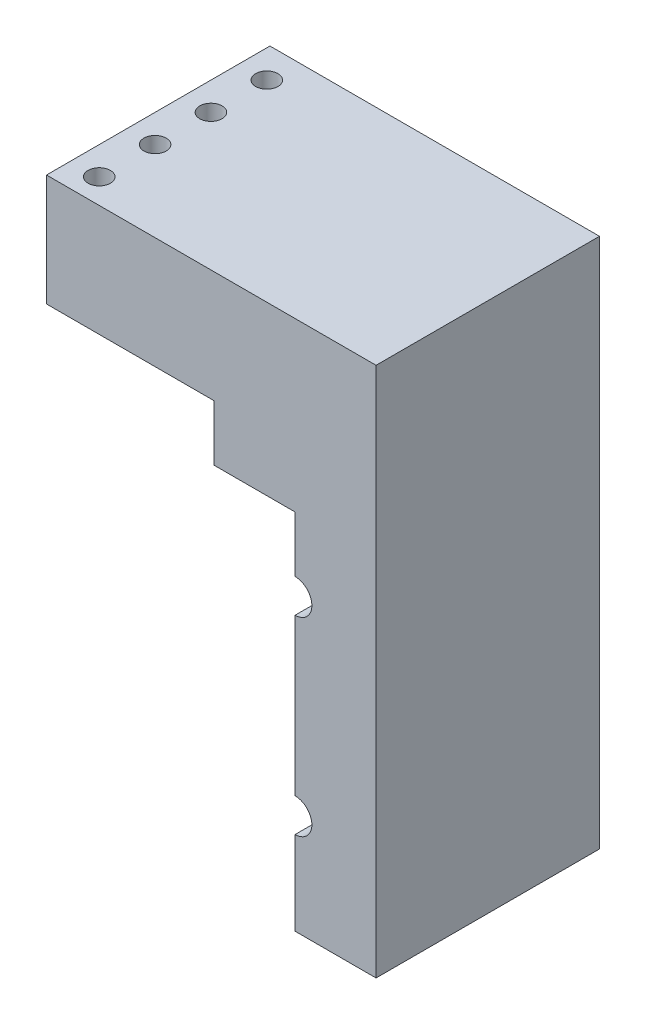
from build123d import *

# Parameters (mm, degrees)
SKETCH_3_W          = 29
SKETCH_3_H          = 95
EXTRUDE_1_DEPTH     = 40
SKETCH_4_R          = 3.005
CUT_EXTRUDE_1_DEPTH = 108.079409785
SKETCH_6_W          = 40
SKETCH_6_H          = 20
EXTRUDE_3_DEPTH     = 30
SKETCH_7_W          = 14.5
SKETCH_7_H          = 65
CUT_EXTRUDE_2_DEPTH = 108.354552768
SKETCH_9_R          = 2
CUT_EXTRUDE_4_DEPTH = 5
SKETCH_10_R         = 2
CUT_EXTRUDE_5_DEPTH = 5
SKETCH_11_R         = 2
CUT_EXTRUDE_6_DEPTH = 5
SKETCH_12_R         = 2
CUT_EXTRUDE_7_DEPTH = 5


with BuildPart() as part:
    # 草图3 → 凸台-拉伸1 (new body)
    with BuildSketch(Plane.XY):
        with Locations((14.5, 47.5)):
            Rectangle(SKETCH_3_W, SKETCH_3_H)
    extrude(amount=EXTRUDE_1_DEPTH)

    # 草图4 → 切除-拉伸1 (cut, through all)
    with BuildSketch(Plane.XY.offset(40)):
        with Locations((14.5, 52)):
            Circle(SKETCH_4_R)
        with Locations((14.5, 18)):
            Circle(SKETCH_4_R)
    extrude(amount=-CUT_EXTRUDE_1_DEPTH, mode=Mode.SUBTRACT)

    # 草图6 → 凸台-拉伸3 (add)
    with BuildSketch(Plane.ZY):
        with Locations((20, 85)):
            Rectangle(SKETCH_6_W, SKETCH_6_H)
    extrude(amount=EXTRUDE_3_DEPTH)

    # 草图7 → 切除-拉伸2 (cut, through all)
    with BuildSketch(Plane.XY.offset(40)):
        with Locations((7.25, 32.5)):
            Rectangle(SKETCH_7_W, SKETCH_7_H)
    extrude(amount=-CUT_EXTRUDE_2_DEPTH, mode=Mode.SUBTRACT)

    # 草图9 → 切除-拉伸4 (cut)
    with BuildSketch(Plane.ZY.offset(-14.5)):
        with Locations((5, 60.0025)):
            Circle(SKETCH_9_R)
        with Locations((15, 60.0025)):
            Circle(SKETCH_9_R)
        with Locations((25, 60.0025)):
            Circle(SKETCH_9_R)
        with Locations((35, 60.0025)):
            Circle(SKETCH_9_R)
    extrude(amount=-CUT_EXTRUDE_4_DEPTH, mode=Mode.SUBTRACT)

    # 草图10 → 切除-拉伸5 (cut)
    with BuildSketch(Plane.ZY.offset(-14.5)):
        with Locations((5, 7.4975)):
            Circle(SKETCH_10_R)
        with Locations((15, 7.4975)):
            Circle(SKETCH_10_R)
        with Locations((25, 7.4975)):
            Circle(SKETCH_10_R)
        with Locations((35, 7.4975)):
            Circle(SKETCH_10_R)
    extrude(amount=-CUT_EXTRUDE_5_DEPTH, mode=Mode.SUBTRACT)

    # 草图11 → 切除-拉伸6 (cut)
    with BuildSketch(Plane.ZY.offset(-14.5)):
        with Locations((5, 35)):
            Circle(SKETCH_11_R)
        with Locations((15, 35)):
            Circle(SKETCH_11_R)
        with Locations((25, 35)):
            Circle(SKETCH_11_R)
        with Locations((35, 35)):
            Circle(SKETCH_11_R)
    extrude(amount=-CUT_EXTRUDE_6_DEPTH, mode=Mode.SUBTRACT)

    # 草图12 → 切除-拉伸7 (cut)
    with BuildSketch(Plane(origin=(0, 95, 0), x_dir=(1, 0, 0), z_dir=(0, 1, 0))):
        with Locations((-25, -35.563533882)):
            Circle(SKETCH_12_R)
        with Locations((-25, -25.563533882)):
            Circle(SKETCH_12_R)
        with Locations((-25, -15.563533882)):
            Circle(SKETCH_12_R)
        with Locations((-25, -5.563533882)):
            Circle(SKETCH_12_R)
    extrude(amount=-CUT_EXTRUDE_7_DEPTH, mode=Mode.SUBTRACT)


solid = part.part
